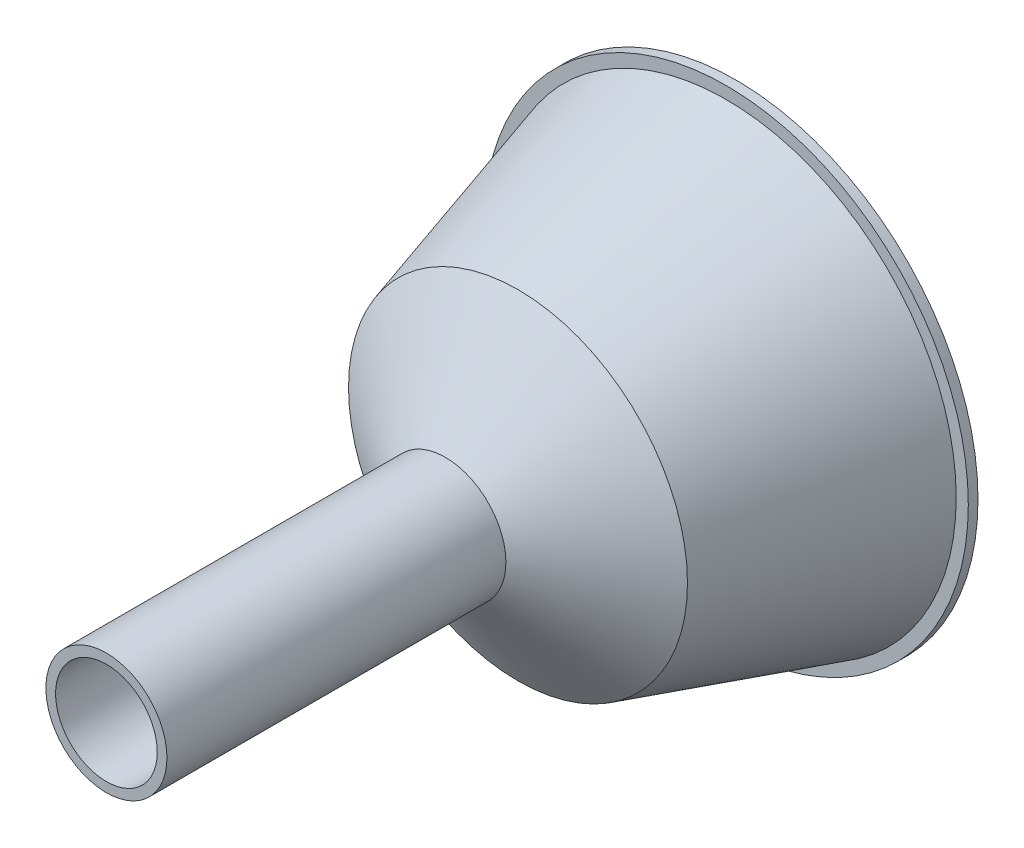
from build123d import *


# Read off the part's stored shape, not the designer's step: Vaciado1
with BuildPart() as part:
    # Croquis1 → Revolución1 (revolve)
    with BuildSketch(Plane(origin=(0, 0, 0), x_dir=(1, 0, 0), z_dir=(0, 1, 0))):
        Polygon((0, -65), (0, 65), (50, 65), (50, 63), (47.5, 63), (35, 20), (12.5, 5), (12.5, -65), align=None)
    revolve(axis=Axis((0, 0, 65), (0, 0, -1)))

    # Vaciado1 outline → Vaciado1 (revolve, cut)
    with BuildSketch(Plane.XZ):
        Polygon((45.99860382, -65), (33.283256487, -21.259205175), (10.5, -6.070367517), (10.5, 65), (0, 65), (0, -65), align=None)
    revolve(axis=Axis((0, 0, 0), (0, 0, 1)), mode=Mode.SUBTRACT)


solid = part.part
